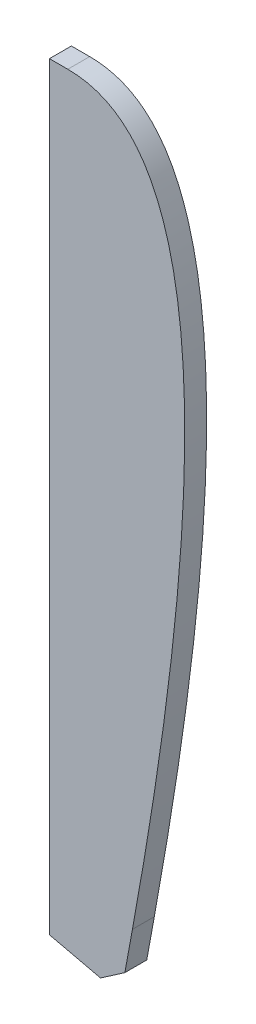
from build123d import *

# Parameters (mm, degrees)
BOSS_EXTRUDE1_DEPTH = 12.7
CHAMFER1_SIZE       = 12.7
CHAMFER1_SIZE2      = 12.14102868


with BuildPart() as part:
    # Sketch2 → Boss-Extrude1 (new body)
    with BuildSketch(Plane.XY):
        Polygon((12.7, -5464.963531619), (54.140557785, -5474.594585325), (136.525, -5024.878404071), (12.7, -5024.878404071), align=None)
    extrude(amount=-BOSS_EXTRUDE1_DEPTH)

    # Fillet1
    # a fillet whose section is not a circle: 406.4, 38.1 mm, written as the material it takes off along each edge
    with BuildSketch(Plane(origin=(136.525, -5024.878404071, 1050.356508865), x_dir=(-0.18019344316526917, -0.9836311925921447, 0), z_dir=(0, 0, -1))) as fillet1_piece_1:
        with BuildLine():
            Bezier((420.142603546, 0), (0, 0), (20.394886876, 111.330615302), weights=[1, 1, 1])
            Line((20.394886876, 111.330615302), (0, 0))
            Line((0, 0), (420.142603546, 0))
        make_face()
    extrude(amount=2113.413017729, mode=Mode.SUBTRACT)

    # Chamfer1
    chamfer1_edges = [part.edges().sort_by_distance(p)[0] for p in [
        (54.140557785, -5474.594585325, -6.35),
    ]]
    chamfer1_side = [part.faces().sort_by_distance(p)[0] for p in [
        (57.479307716, -5456.36917979, -6.35),
    ]]
    chamfer(chamfer1_edges, length=CHAMFER1_SIZE, length2=CHAMFER1_SIZE2, reference=chamfer1_side[0])


solid = part.part
